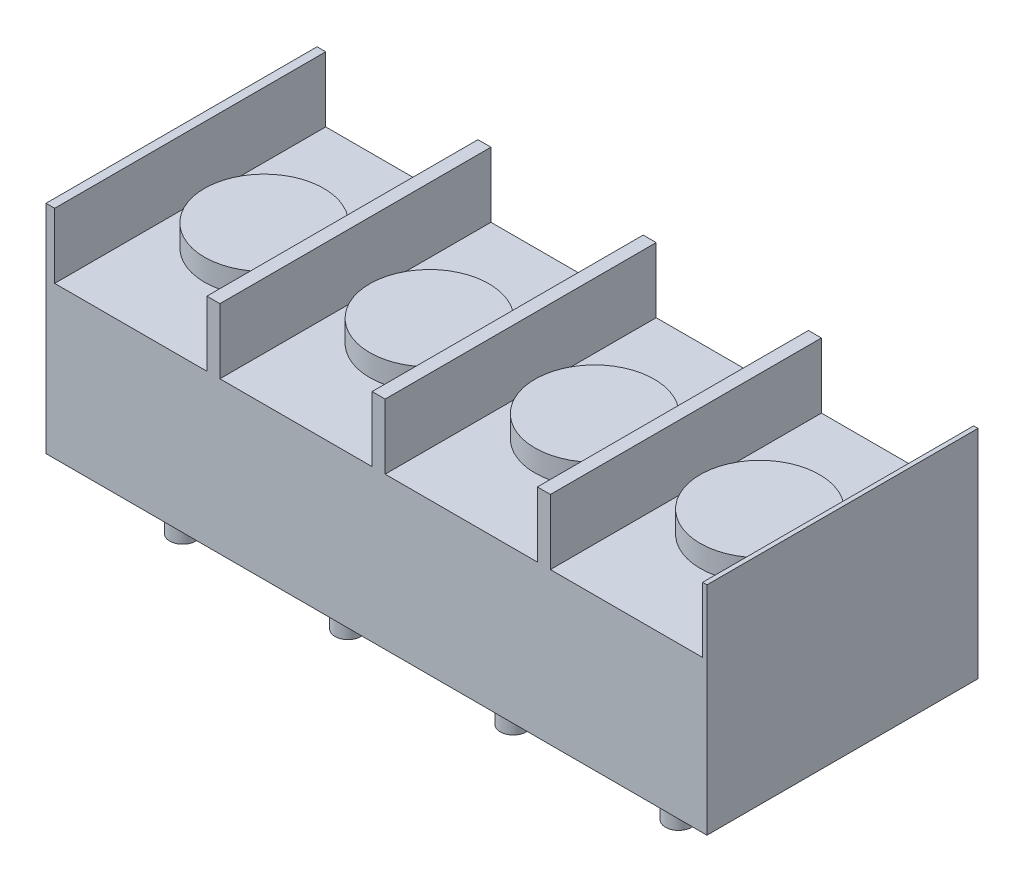
from build123d import *

# Parameters (mm, degrees)
SKETCH_1_W          = 30.48
SKETCH_1_H          = 12.5
EXTRUDE_1_DEPTH     = 10
SKETCH_2_W          = 7.02
SKETCH_2_H          = 12.5
CUT_EXTRUDE_1_DEPTH = 3
SKETCH_3_R          = 0.6
EXTRUDE_2_DEPTH     = 2.54
SKETCH_4_R          = 2.75
EXTRUDE_3_DEPTH     = 1


with BuildPart() as part:
    # 草图1 → 拉伸1 (new body)
    with BuildSketch(Plane(origin=(0, 0, 0), x_dir=(1, 0, 0), z_dir=(0, 1, 0))):
        Rectangle(SKETCH_1_W, SKETCH_1_H)
    extrude(amount=EXTRUDE_1_DEPTH)

    # 草图2 → 切除-拉伸1 (cut)
    with BuildSketch(Plane(origin=(0, 10, 0), x_dir=(-1, 0, 0), z_dir=(0, 1, 0))):
        with Locations((3.71, 0)):
            Rectangle(SKETCH_2_W, SKETCH_2_H)
        with Locations((11.33, 0)):
            Rectangle(SKETCH_2_W, SKETCH_2_H)
        with Locations((-3.91, 0)):
            Rectangle(SKETCH_2_W, SKETCH_2_H)
        with Locations((-11.53, 0)):
            Rectangle(SKETCH_2_W, SKETCH_2_H)
    extrude(amount=-CUT_EXTRUDE_1_DEPTH, mode=Mode.SUBTRACT)

    # 草图3 → 拉伸2 (add)
    with BuildSketch(Plane.XZ):
        with Locations((3.81, 3.75)):
            Circle(SKETCH_3_R)
        with Locations((11.43, 3.75)):
            Circle(SKETCH_3_R)
        with Locations((-3.81, 3.75)):
            Circle(SKETCH_3_R)
        with Locations((-11.43, 3.75)):
            Circle(SKETCH_3_R)
    extrude(amount=EXTRUDE_2_DEPTH)

    # 草图4 → 拉伸3 (add)
    with BuildSketch(Plane(origin=(0, 7, 0), x_dir=(-1, 0, 0), z_dir=(0, 1, 0))):
        with Locations((-3.81, 0)):
            Circle(SKETCH_4_R)
        with Locations((3.81, 0)):
            Circle(SKETCH_4_R)
        with Locations((11.43, 0)):
            Circle(SKETCH_4_R)
        with Locations((-11.43, 0)):
            Circle(SKETCH_4_R)
    extrude(amount=EXTRUDE_3_DEPTH)


solid = part.part
